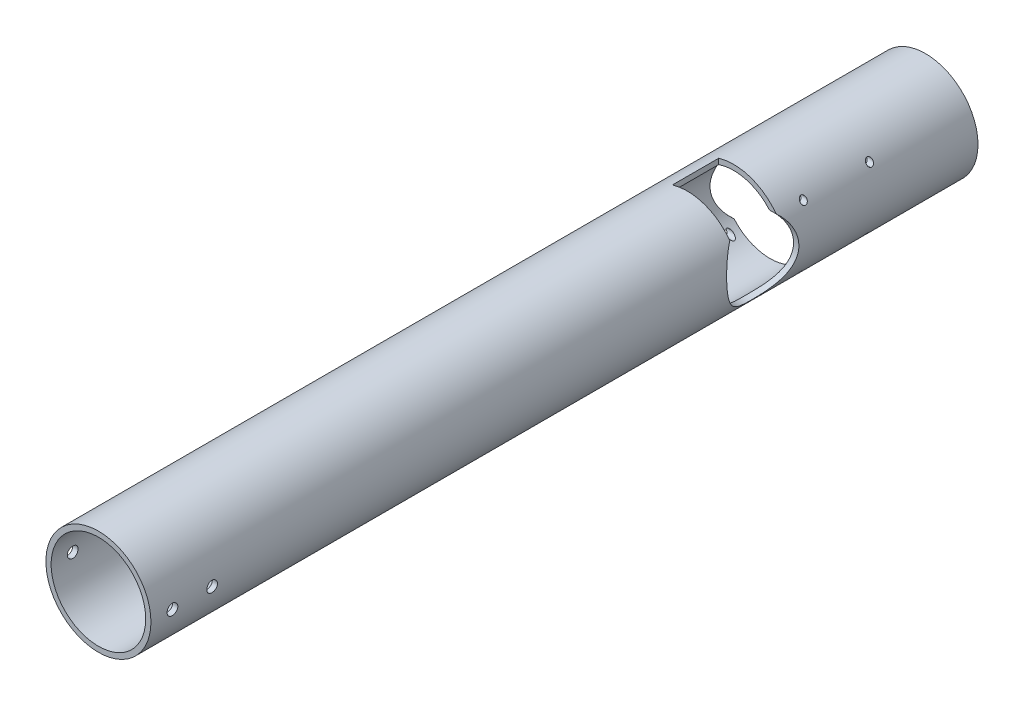
from build123d import *

# Parameters (mm, degrees)
BOSS_EXTRUDE1_DEPTH      = 250
BOSS_EXTRUDE1_DEPTH_BACK = 250
SKETCH1_R                = 31.75
SKETCH1_R_2              = 28.575
SKETCH2_R                = 21.75
CUT_EXTRUDE1_DEPTH       = 255.000246063
SKETCH3_R                = 21.75
CUT_EXTRUDE2_DEPTH       = 255.000246186
CUT_EXTRUDE4_START       = 9
SKETCH5_W                = 28
SKETCH5_H                = 22
CUT_EXTRUDE4_DEPTH       = 264.000246186
CUT_EXTRUDE5_START       = -9
SKETCH6_W                = 28
SKETCH6_H                = 22
CUT_EXTRUDE5_DEPTH       = 264.000246186
CUT_EXTRUDE8_DEPTH       = 255.000246186
CUT_EXTRUDE8_DEPTH_BACK  = 255.000246186
SKETCH11_R               = 2
CUT_EXTRUDE10_DEPTH      = 255.000246186
CUT_EXTRUDE10_DEPTH_BACK = 255.000246186
SKETCH12_R               = 3.25


with BuildPart() as part:
    # Sketch1 → Boss-Extrude1 (new, two sides: drawn at the far end of the back side and taken through both)
    with BuildSketch(Plane.XY.offset(-BOSS_EXTRUDE1_DEPTH_BACK)):
        Circle(SKETCH1_R)
        Circle(SKETCH1_R_2, mode=Mode.SUBTRACT)
    extrude(amount=BOSS_EXTRUDE1_DEPTH + BOSS_EXTRUDE1_DEPTH_BACK)

    # Sketch2 → Cut-Extrude1 (cut, through all)
    with BuildSketch(Plane(origin=(0, 0, 0), x_dir=(0, 0, -1), z_dir=(1, 0, 0))):
        with Locations((170, -2)):
            Circle(SKETCH2_R)
    extrude(amount=-CUT_EXTRUDE1_DEPTH, mode=Mode.SUBTRACT)

    # Sketch3 → Cut-Extrude2 (cut, through all)
    with BuildSketch(Plane(origin=(0, 0, 0), x_dir=(0, 0, -1), z_dir=(1, 0, 0))):
        with Locations((120, 2)):
            Circle(SKETCH3_R)
    extrude(amount=CUT_EXTRUDE2_DEPTH, mode=Mode.SUBTRACT)

    # Sketch5 → Cut-Extrude4 (cut, through all)
    with BuildSketch(Plane(origin=(0, 0, 0), x_dir=(0, 0, -1), z_dir=(1, 0, 0)).offset(CUT_EXTRUDE4_START)):
        with Locations((170, -23.75)):
            Rectangle(SKETCH5_W, SKETCH5_H)
    extrude(amount=-CUT_EXTRUDE4_DEPTH, mode=Mode.SUBTRACT)

    # Sketch6 → Cut-Extrude5 (cut, through all)
    with BuildSketch(Plane(origin=(0, 0, 0), x_dir=(0, 0, -1), z_dir=(1, 0, 0)).offset(CUT_EXTRUDE5_START)):
        with Locations((120, 23.75)):
            Rectangle(SKETCH6_W, SKETCH6_H)
    extrude(amount=CUT_EXTRUDE5_DEPTH, mode=Mode.SUBTRACT)

    # Sketch11 → Cut-Extrude8 (cut, two sides: drawn at the far end of the back side and taken through both)
    with BuildSketch(Plane(origin=(0, 0, 0), x_dir=(0, 0, -1), z_dir=(1, 0, 0)).offset(-CUT_EXTRUDE8_DEPTH_BACK)):
        with Locations((190, 18)):
            Circle(SKETCH11_R)
        with Locations((150, 18)):
            Circle(SKETCH11_R)
        with Locations((150, -22)):
            Circle(SKETCH11_R)
        with Locations((190, -22)):
            Circle(SKETCH11_R)
    extrude(amount=CUT_EXTRUDE8_DEPTH + CUT_EXTRUDE8_DEPTH_BACK, mode=Mode.SUBTRACT)

    # Sketch12 → Cut-Extrude10 (cut, two sides: drawn at the far end of the back side and taken through both)
    with BuildSketch(Plane(origin=(0, 0, 0), x_dir=(0, 0, -1), z_dir=(1, 0, 0)).offset(-CUT_EXTRUDE10_DEPTH_BACK)):
        with Locations((-213, 0)):
            Circle(SKETCH12_R)
        with Locations((-237, 0)):
            Circle(SKETCH12_R)
    extrude(amount=CUT_EXTRUDE10_DEPTH + CUT_EXTRUDE10_DEPTH_BACK, mode=Mode.SUBTRACT)


solid = part.part
